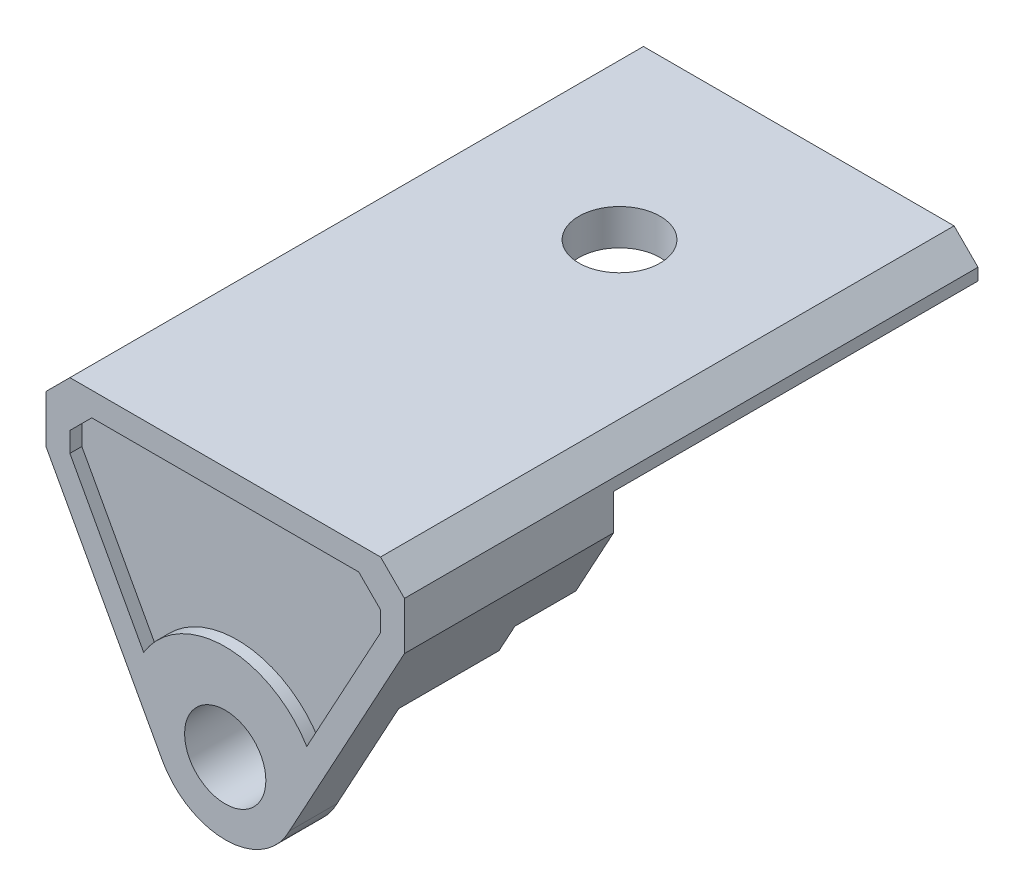
from build123d import *
from build123d.topology import SkipClean

# Parameters (mm, degrees)
BOSS_EXTRUDE1_DEPTH  = 2
BOSS_EXTRUDE2_START  = 4.75
BOSS_EXTRUDE2_DEPTH  = 4.75
BOSS_EXTRUDE3_START  = 2
SKETCH3_R            = 3
SKETCH3_R_2          = 1.7
BOSS_EXTRUDE3_DEPTH  = 2
SKETCH4_R            = 2.2
SKETCH4_R_2          = 1.7
BOSS_EXTRUDE4_DEPTH  = 0.5
CHAMFER1_SIZE        = 0.5
SKETCH5_W            = 7.5
SKETCH5_H            = 3
BOSS_EXTRUDE5_DEPTH  = 2
BOSS_EXTRUDE6_DEPTH  = 4.2
BOSS_EXTRUDE8_DEPTH  = 6.75
SKETCH10_W           = 15
SKETCH10_H           = 3
BOSS_EXTRUDE9_DEPTH  = 15.25
SKETCH11_R           = 1.65
CUT_EXTRUDE1_DEPTH   = 22.542109925
FILLET1_R            = 0.2
CHAMFER6_SIZE        = 1.5
BOSS_EXTRUDE12_REACH = 29.249
SKETCH16_W           = 15
SKETCH16_H           = 1.5
CUT_EXTRUDE3_DEPTH   = 0.5
CHAMFER7_SIZE        = 1
CUT_EXTRUDE4_DEPTH   = 15.25
SKETCH18_R           = 1.7
CUT_EXTRUDE5_DEPTH   = 10


with BuildPart() as part:
    # Sketch1 → Boss-Extrude1 (new body)
    with BuildSketch(Plane.XY):
        with BuildLine():
            Line((4.594082841, 4.876925553), (5.159993549, 5.442836262))
            ThreePointArc((5.159993549, 5.442836262), (0, 7.5), (-5.159993549, 5.442836262))
            Line((-5.159993549, 5.442836262), (-4.594082841, 4.876925553))
            ThreePointArc((-4.594082841, 4.876925553), (0, 6.7), (4.594082841, 4.876925553))
        make_face()
    extrude(amount=-BOSS_EXTRUDE1_DEPTH)

    # Sketch1<3> → Boss-Extrude2 (add)
    with BuildSketch(Plane.XY.offset(BOSS_EXTRUDE2_START)):
        with BuildLine():
            Line((4.594082841, 4.876925553), (5.159993549, 5.442836262))
            ThreePointArc((5.159993549, 5.442836262), (0, 7.5), (-5.159993549, 5.442836262))
            Line((-5.159993549, 5.442836262), (-4.594082841, 4.876925553))
            ThreePointArc((-4.594082841, 4.876925553), (0, 6.7), (4.594082841, 4.876925553))
        make_face()
    extrude(amount=-BOSS_EXTRUDE2_DEPTH)

    # Sketch3 → Boss-Extrude3 (add)
    # profile 1 of 4: a face of its own
    with BuildSketch(Plane.XY.offset(4.75).offset(BOSS_EXTRUDE3_START)):
        with BuildLine():
            Line((-4.594082841, 4.876925553), (-5.159993549, 5.442836262))
            Line((-5.159993549, 5.442836262), (-2.820975701, -1.02083108))
            ThreePointArc((-2.820975701, -1.02083108), (-2.892694114, 0.795185994), (-1.902774006, 2.31936437))
            Line((-1.902774006, 2.31936437), (-2.780654635, 4.745309242))
            ThreePointArc((-2.780654635, 4.745309242), (0, 5.5), (2.780654635, 4.745309242))
            Line((2.780654635, 4.745309242), (1.902774006, 2.31936437))
            ThreePointArc((1.902774006, 2.31936437), (2.711855639, 1.282902565), (3, 0))
            ThreePointArc((3, 0), (2.954904999, -0.518205025), (2.820975701, -1.02083108))
            Line((2.820975701, -1.02083108), (5.159993549, 5.442836262))
            Line((5.159993549, 5.442836262), (4.594082841, 4.876925553))
            ThreePointArc((4.594082841, 4.876925553), (0, 6.7), (-4.594082841, 4.876925553))
        make_face()
    # profile 2 of 4: a face of its own
    with BuildSketch(Plane.XY.offset(4.75).offset(BOSS_EXTRUDE3_START)):
        with BuildLine():
            Line((-5.159993549, 5.442836262), (-4.594082841, 4.876925553))
            ThreePointArc((-4.594082841, 4.876925553), (0, 6.7), (4.594082841, 4.876925553))
            Line((4.594082841, 4.876925553), (5.159993549, 5.442836262))
            ThreePointArc((5.159993549, 5.442836262), (0, 7.5), (-5.159993549, 5.442836262))
        make_face()
    # profile 3 of 4: a face of its own
    with BuildSketch(Plane.XY.offset(4.75).offset(BOSS_EXTRUDE3_START)):
        Circle(SKETCH3_R)
        Circle(SKETCH3_R_2, mode=Mode.SUBTRACT)
    # profile 4 of 4: a face of its own
    with BuildSketch(Plane.XY.offset(4.75).offset(BOSS_EXTRUDE3_START)):
        with BuildLine():
            Line((-2.780654635, 4.745309242), (-1.902774006, 2.31936437))
            ThreePointArc((-1.902774006, 2.31936437), (0, 3), (1.902774006, 2.31936437))
            Line((1.902774006, 2.31936437), (2.780654635, 4.745309242))
            ThreePointArc((2.780654635, 4.745309242), (0, 5.5), (-2.780654635, 4.745309242))
        make_face()
    extrude(amount=-BOSS_EXTRUDE3_DEPTH)

    # Sketch4 → Boss-Extrude4 (add)
    with SkipClean():  # the faces are left unmerged after this step: merging them gives an invalid solid
        with BuildSketch(Plane(origin=(0, 0, 4.75), x_dir=(-1, 0, 0), z_dir=(0, 0, -1))):
            with Locations(Location((0, 0, 0), (0, 0, 180))):
                Circle(SKETCH4_R)
            Circle(SKETCH4_R_2, mode=Mode.SUBTRACT)
        extrude(amount=BOSS_EXTRUDE4_DEPTH)
    add(part.part.scale(1), mode=Mode.REPLACE)  # the faces are merged on a copy

    # Chamfer1
    chamfer1_edges = [part.edges().sort_by_distance(p)[0] for p in [
        (-2.2, 0, 4.75),
    ]]
    chamfer(chamfer1_edges, length=CHAMFER1_SIZE - 0.0001)  # a hair under: the kernel refuses the full size

    # Sketch5 → Boss-Extrude5 (add)
    with BuildSketch(Plane.XY.offset(6.75)):
        with BuildLine():
            ThreePointArc((-5.159993549, 5.442836262), (-2.777474396, 6.966752183), (0, 7.5))
            Line((0, 7.5), (-7.5, 7.5))
            Line((-7.5, 7.5), (-2.634698995, -1.434698995))
            ThreePointArc((-2.634698995, -1.434698995), (-2.735675101, -1.231292711), (-2.820975701, -1.02083108))
            Line((-2.820975701, -1.02083108), (-5.159993549, 5.442836262))
        make_face()
        with Locations((-3.75, 9)):
            Rectangle(SKETCH5_W, SKETCH5_H)
        with Locations((3.75, 9)):
            Rectangle(SKETCH5_W, SKETCH5_H)
        with BuildLine():
            Line((7.5, 7.5), (0, 7.5))
            ThreePointArc((0, 7.5), (2.777474396, 6.966752183), (5.159993549, 5.442836262))
            Line((5.159993549, 5.442836262), (2.820975701, -1.02083108))
            ThreePointArc((2.820975701, -1.02083108), (2.756369418, -1.184241374), (2.682306676, -1.343588812))
            Line((2.682306676, -1.343588812), (7.5, 7.5))
        make_face()
    extrude(amount=-BOSS_EXTRUDE5_DEPTH)

    # Sketch6 → Boss-Extrude6 (add)
    with SkipClean():  # the faces are left unmerged after this step: merging them gives an invalid solid
        with BuildSketch(Plane(origin=(0, 0, 4.75), x_dir=(-1, 0, 0), z_dir=(0, 0, -1))):
            with BuildLine():
                Line((-5.921621025, 4.602651891), (-5.499242594, 3.827313795))
                ThreePointArc((-5.499242594, 3.827313795), (-5.073876801, 4.375588441), (-4.594082841, 4.876925553))
                Line((-4.594082841, 4.876925553), (-5.159993549, 5.442836262))
                ThreePointArc((-5.159993549, 5.442836262), (-5.556709713, 5.037159632), (-5.921621025, 4.602651891))
            make_face()
            with BuildLine():
                Line((5.159993549, 5.442836262), (4.594082841, 4.876925553))
                ThreePointArc((4.594082841, 4.876925553), (5.074143899, 4.375278699), (5.499709828, 3.826642367))
                Line((5.499709828, 3.826642367), (5.922007367, 4.602154794))
                ThreePointArc((5.922007367, 4.602154794), (5.556921127, 5.036926403), (5.159993549, 5.442836262))
            make_face()
            with BuildLine():
                Line((-5.499242594, 3.827313795), (-5.256310338, 3.381375701))
                ThreePointArc((-5.256310338, 3.381375701), (-4.806527723, 3.994970744), (-4.285525038, 4.549370852))
                Line((-4.285525038, 4.549370852), (-4.594082841, 4.876925553))
                ThreePointArc((-4.594082841, 4.876925553), (-5.073876801, 4.375588441), (-5.499242594, 3.827313795))
            make_face()
            with BuildLine():
                Line((4.594082841, 4.876925553), (4.275732705, 4.558575417))
                ThreePointArc((4.275732705, 4.558575417), (4.802528974, 3.999776925), (5.256816116, 3.380589346))
                Line((5.256816116, 3.380589346), (5.499709828, 3.826642367))
                ThreePointArc((5.499709828, 3.826642367), (5.074143899, 4.375278699), (4.594082841, 4.876925553))
            make_face()
        extrude(amount=BOSS_EXTRUDE6_DEPTH)

    # Sketch8 → Boss-Extrude8 (add)
    with BuildSketch(Plane(origin=(0, 0, 4.75), x_dir=(-1, 0, 0), z_dir=(0, 0, -1))):
        with BuildLine():
            Line((5.922007367, 4.602154794), (7.5, 7.5))
            Line((7.5, 7.5), (7.5, 10.5))
            Line((7.5, 10.5), (-7.5, 10.5))
            Line((-7.5, 10.5), (-7.5, 7.5))
            Line((-7.5, 7.5), (-5.921621025, 4.602651891))
            ThreePointArc((-5.921621025, 4.602651891), (0.000314788, 7.499999993), (5.922007367, 4.602154794))
        make_face()
    extrude(amount=BOSS_EXTRUDE8_DEPTH)

    # Sketch10 → Boss-Extrude9 (add)
    with BuildSketch(Plane(origin=(0, 0, -2), x_dir=(-1, 0, 0), z_dir=(0, 0, -1))):
        with Locations((0, 9)):
            Rectangle(SKETCH10_W, SKETCH10_H)
    extrude(amount=BOSS_EXTRUDE9_DEPTH)

    # Sketch11 → Cut-Extrude1 (cut, through all)
    with BuildSketch(Plane.XZ.offset(-7.5)):
        with Locations(Location((0, -9.5, 0), (0, 0, 270))):
            Circle(SKETCH11_R)
    extrude(amount=-CUT_EXTRUDE1_DEPTH, mode=Mode.SUBTRACT)

    # Fillet1
    fillet1_edges = [part.edges().sort_by_distance(p)[0] for p in [
        (4.285525038, 4.549370852, 2.65),
        (-4.275732705, 4.558575417, 2.65),
    ]]
    fillet(fillet1_edges, radius=FILLET1_R)

    # Chamfer6
    chamfer6_edges = [part.edges().sort_by_distance(p)[0] for p in [
        (7.5, 10.5, -5.25),
        (-7.5, 10.5, -5.25),
    ]]
    chamfer(chamfer6_edges, length=CHAMFER6_SIZE)

    # Boss-Extrude12: up to this face of the body (flat: up to its plane)
    boss_extrude12_end = Plane(part.part.faces().sort_by_distance((-0.00029363, 5.45528482, 6.75))[0])
    # Sketch16 → Boss-Extrude12 (add, up to the picked face)
    with BuildSketch(Plane(origin=(0, 0, -17.25), x_dir=(-1, 0, 0), z_dir=(0, 0, -1)), mode=Mode.PRIVATE) as boss_extrude12_sk1:
        with Locations((0, 9.75)):
            Rectangle(SKETCH16_W, SKETCH16_H)
    boss_extrude12_tool1 = split(extrude(boss_extrude12_sk1.sketch, amount=-BOSS_EXTRUDE12_REACH, mode=Mode.PRIVATE), bisect_by=boss_extrude12_end, keep=Keep.BOTH, mode=Mode.PRIVATE)
    add(boss_extrude12_tool1.solids().sort_by(Axis((0, 9.75, -17.25), (0, 0, 1)))[0])

    # Sketch13 → Cut-Extrude3 (cut)
    with BuildSketch(Plane.XY.offset(6.75)):
        with BuildLine():
            ThreePointArc((3.4124071, 2.086978147), (-0.000677338, 3.999999943), (-3.413113698, 2.085822351))
            Line((-3.413113698, 2.085822351), (-6.5, 7.754618569))
            Line((-6.5, 7.754618569), (-6.5, 8.585786438))
            Line((-6.5, 8.585786438), (-5.585786438, 9.5))
            Line((-5.585786438, 9.5), (5.585786438, 9.5))
            Line((5.585786438, 9.5), (6.5, 8.585786438))
            Line((6.5, 8.585786438), (6.5, 7.754711685))
            Line((6.5, 7.754711685), (3.4124071, 2.086978147))
        make_face()
    extrude(amount=-CUT_EXTRUDE3_DEPTH, mode=Mode.SUBTRACT)

    # Chamfer7
    chamfer7_edges = [part.edges().sort_by_distance(p)[0] for p in [
        (7.5, 10.5, -5.25),
        (-7.5, 10.5, -5.25),
    ]]
    chamfer(chamfer7_edges, length=CHAMFER7_SIZE)

    # Sketch17 → Cut-Extrude4 (cut)
    with BuildSketch(Plane(origin=(0, 0, -17.25), x_dir=(-1, 0, 0), z_dir=(0, 0, -1))):
        Polygon((7.5, 9), (-6.884093455, 9), (-7.5, 9), (-7.5, 7.5), (7.5, 7.5), align=None)
    extrude(amount=-CUT_EXTRUDE4_DEPTH, mode=Mode.SUBTRACT)

    # Sketch18 → Cut-Extrude5 (cut)
    with BuildSketch(Plane(origin=(0, 10.5, 0), x_dir=(1, 0, 0), z_dir=(0, 1, 0))):
        with Locations(Location((0, 9.75, 0), (0, 0, 180))):
            Circle(SKETCH18_R)
    extrude(amount=-CUT_EXTRUDE5_DEPTH, mode=Mode.SUBTRACT)


solid = part.part
